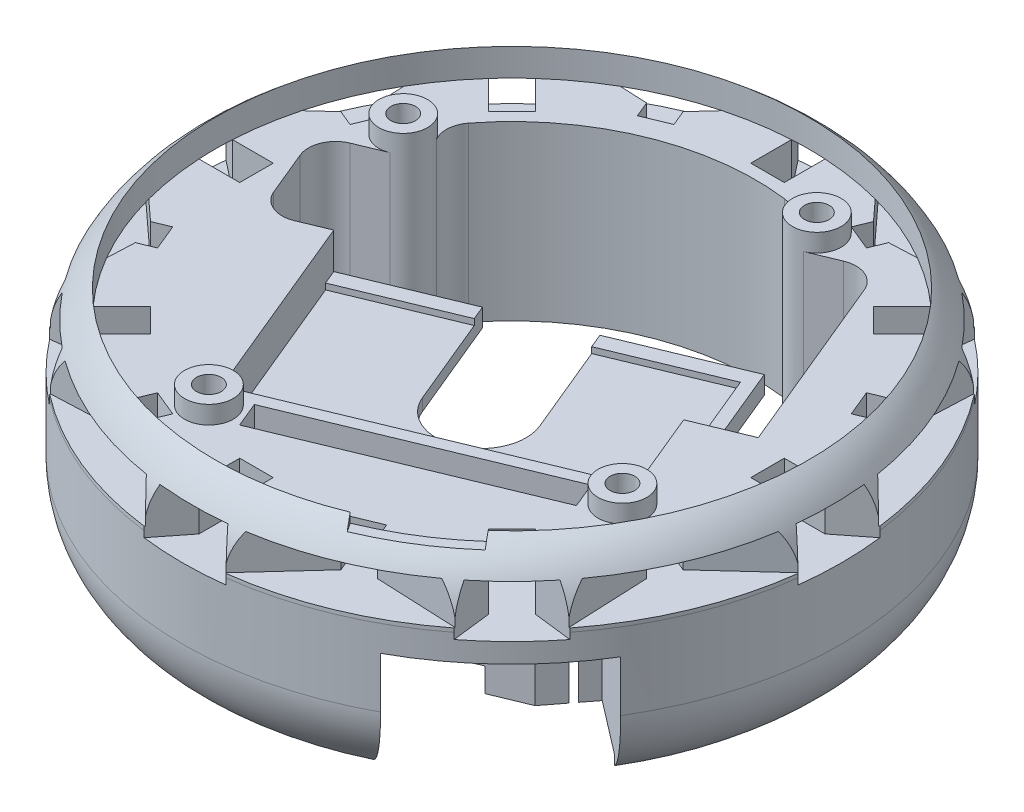
from build123d import *
from build123d.topology import SkipClean

# Parameters (mm, degrees)
SKETCH1_R                  = 49.53
BOSS_EXTRUDE1_DEPTH        = 9
BOSS_EXTRUDE12_START       = -30.41
SKETCH35_R                 = 55
SKETCH35_R_2               = 49.53
BOSS_EXTRUDE12_DEPTH       = 35
FILLET15_R                 = 14
CUT_EXTRUDE2_START         = -7.55
CUT_EXTRUDE2_DEPTH         = 7.55
CUT_EXTRUDE6_START         = -5.89
CUT_EXTRUDE6_DEPTH         = 5.89
CIRPATTERN1_COUNT          = 8
CIRPATTERN2_COUNT          = 8
SKETCH2_R                  = 40.65
CUT_EXTRUDE1_DEPTH         = 84.5150771477823
BOSS_EXTRUDE5_DEPTH        = 9
CUT_EXTRUDE25_DEPTH        = 84.5150771477823
CUT_EXTRUDE25_DEPTH_BACK   = 84.5150771477823
SKETCH22_R                 = 2.064000000000005
CUT_EXTRUDE12_DEPTH        = 84.5150771477823
BOSS_EXTRUDE6_DEPTH        = 2
SKETCH32_R                 = 2.064
CUT_EXTRUDE16_DEPTH        = 84.5150771477823
CUT_EXTRUDE19_DEPTH        = 6
BOSS_EXTRUDE10_OUTLINE_R   = 49.53
BOSS_EXTRUDE10_OUTLINE_R_2 = 2.064
BOSS_EXTRUDE10_OUTLINE_R_3 = 2.065
BOSS_EXTRUDE10_DEPTH       = 19.82
FILLET13_R                 = 4.5
CUT_EXTRUDE18_START        = -11.530000000000001
CUT_EXTRUDE18_DEPTH        = 10.5
FILLET9_R                  = 1.6
BOSS_EXTRUDE13_START       = 1.59
BOSS_EXTRUDE13_DEPTH       = 1.59
CUT_EXTRUDE20_DEPTH        = 2
FILLET9_OF_MIRROR9_R       = 1.6
CUT_EXTRUDE21_DEPTH        = 4
CUT_EXTRUDE22_DEPTH        = 18.240000000000002
CUT_EXTRUDE23_DEPTH        = 9
CUT_EXTRUDE24_DEPTH        = 6
BOSS_EXTRUDE15_START       = 3
SKETCH52_R                 = 4.064999999999999
SKETCH52_R_2               = 2.0639999999999983
SKETCH52_R_3               = 2.0639999999999965
SKETCH52_R_4               = 4.065
SKETCH52_R_5               = 2.0640000000000014
SKETCH52_R_6               = 2.064000000000005
BOSS_EXTRUDE15_DEPTH       = 3
CUT_EXTRUDE26_START        = 3
CUT_EXTRUDE26_DEPTH        = 81.51507725005126
CUT_EXTRUDE28_DEPTH        = 85.6535771759353
CUT_EXTRUDE28_DEPTH_BACK   = 3.6
CUT_EXTRUDE29_DEPTH        = 85.6535771759353
CUT_EXTRUDE29_DEPTH_BACK   = 18


# Read off the part's stored shape, not the designer's step: Boss-Extrude10
with BuildPart() as part:
    # Sketch1 → Boss-Extrude1 (new body)
    with BuildSketch(Plane(origin=(0, 0, 0), x_dir=(1, 0, 0), z_dir=(0, 1, 0))):
        with Locations(Location((0, 0, 0), (0, 0, 270))):
            Circle(SKETCH1_R)
    extrude(amount=BOSS_EXTRUDE1_DEPTH)

    # Sketch35 → Boss-Extrude12 (add)
    with BuildSketch(Plane(origin=(0, 9, 0), x_dir=(1, 0, 0), z_dir=(0, 1, 0)).offset(BOSS_EXTRUDE12_START)):
        with Locations(Location((0, 0, 0), (0, 0, 270))):
            Circle(SKETCH35_R)
        with Locations(Location((0, 0, 0), (0, 0, 270))):
            Circle(SKETCH35_R_2, mode=Mode.SUBTRACT)
    extrude(amount=BOSS_EXTRUDE12_DEPTH)

    # Fillet15
    # the kernel refuses this fillet: 14 mm, written as the material it takes off along each edge
    with BuildSketch(Plane(origin=(0, -21.41, 0), x_dir=(-1.8e-16, 0, 1), z_dir=(-1, 0, -1.8e-16))) as fillet15_piece_1:
        with BuildLine():
            CenterArc((41, 11.101310733422428), FILLET15_R, 307.53787335909544, 52.46212664090456)
            Line((49.53, 0), (49.7006, -0.22202621466844974))
            ThreePointArc((49.7006, -0.22202621466844974), (52.265, -0.28000000000000114), (55, -0.28000000000000114))
            Line((55, -0.28000000000000114), (55.28, 0))
            Line((55.28, 0), (55.28, 11.101310733422428))
            Line((55.28, 11.101310733422428), (55, 11.101310733422428))
        make_face()
    revolve(axis=Axis((0, -21.41, 0), (0, 1, 0)), mode=Mode.SUBTRACT)
    with BuildSketch(Plane(origin=(0, 13.59, 0), x_dir=(-1.8e-16, 0, 1), z_dir=(-1, 0, -1.8e-16))) as fillet15_piece_2:
        with BuildLine():
            CenterArc((41, -11.101310733422427), FILLET15_R, 0, 52.46212664090458)
            Line((49.53, 0), (49.7006, 0.22202621466844796))
            ThreePointArc((49.7006, 0.22202621466844796), (52.265, 0.27999999999999936), (55, 0.27999999999999936))
            Line((55, 0.27999999999999936), (55.28, 0))
            Line((55.28, 0), (55.28, -11.101310733422427))
            Line((55.28, -11.101310733422427), (55, -11.101310733422427))
        make_face()
    revolve(axis=Axis((0, 13.59, 0), (0, 1, 0)), mode=Mode.SUBTRACT)

    # Sketch3 → Cut-Extrude2 (cut)
    with BuildSketch(Plane(origin=(0, 9, 0), x_dir=(1, 0, 0), z_dir=(0, 1, 0)).offset(CUT_EXTRUDE2_START)):
        with BuildLine():
            Line((-2.7999999999999914, -49.4517830676869), (-2.7999999999999914, -42.64999999999999))
            Line((-2.7999999999999914, -42.64999999999999), (2.800000000000009, -42.64999999999999))
            Line((2.800000000000009, -42.64999999999999), (2.800000000000009, -49.4517830676869))
            Line((2.800000000000009, -49.4517830676869), (6.837503484166983, -54.57333182154086))
            ThreePointArc((6.837503484166983, -54.57333182154086), (3.37e-15, -54.99999999999999), (-6.8375034841669615, -54.573331821540854))
            Line((-6.8375034841669615, -54.573331821540854), (-2.7999999999999914, -49.4517830676869))
        make_face()
    cut_extrude2 = extrude(amount=CUT_EXTRUDE2_DEPTH, mode=Mode.SUBTRACT)

    # Sketch9 → Cut-Extrude6 (cut)
    with BuildSketch(Plane(origin=(0, 9, 0), x_dir=(1, 0, 0), z_dir=(0, 1, 0)).offset(CUT_EXTRUDE6_START)):
        with BuildLine():
            Line((-20.200334185550535, -42.6662717092523), (-33.95556960487727, -43.26683825758862))
            ThreePointArc((-33.95556960487727, -43.26683825758862), (-21.047588780079966, -50.813374288120755), (-6.584061205781987, -54.60448825910299))
            Line((-6.584061205781987, -54.60448825910299), (-15.885816768722863, -44.453403338397266))
            Line((-15.885816768722863, -44.453403338397266), (-14.7994441796833, -41.83066790014758))
            Line((-14.7994441796833, -41.83066790014758), (-19.113961596511007, -40.04353627100263))
            Line((-19.113961596511007, -40.04353627100263), (-20.200334185550535, -42.6662717092523))
        make_face()
    cut_extrude6 = extrude(amount=CUT_EXTRUDE6_DEPTH, mode=Mode.SUBTRACT)

    # CirPattern1: Cut-Extrude2 ×8 about axis
    cirpattern1_axis = Axis((-1.58e-15, 0, -1.31e-15), (0, 1, 0))
    for i in range(1, CIRPATTERN1_COUNT):
        add(cut_extrude2.rotate(cirpattern1_axis, i * 360 / CIRPATTERN1_COUNT), mode=Mode.SUBTRACT)

    # CirPattern2: Cut-Extrude6 ×8 about axis
    cirpattern2_axis = Axis((8.5e-16, 0, -2.29e-15), (0, 1, 0))
    for i in range(1, CIRPATTERN2_COUNT):
        add(cut_extrude6.rotate(cirpattern2_axis, i * 360 / CIRPATTERN2_COUNT), mode=Mode.SUBTRACT)

    # Sketch2 → Cut-Extrude1 (cut, through all)
    with BuildSketch(Plane(origin=(0, 9, 0), x_dir=(1, 0, 0), z_dir=(0, 1, 0))):
        with Locations(Location((0, 0, 0), (0, 0, 270))):
            Circle(SKETCH2_R)
    extrude(amount=-CUT_EXTRUDE1_DEPTH, mode=Mode.SUBTRACT)

    # Sketch13 → Boss-Extrude5 (add)
    # profile 1 of 3: a face of its own
    with BuildSketch(Plane(origin=(0, 9, 0), x_dir=(1, 0, 0), z_dir=(0, 1, 0))):
        with BuildLine():
            Line((-38.45360589331033, -1.3157103792115723), (-40.490185271032125, 3.6010271753338756))
            ThreePointArc((-40.490185271032125, 3.6010271753338756), (15.556081525640508, -37.55570299658397), (26.084573841731473, 31.177195311561583))
            Line((26.084573841731473, 31.177195311561583), (29.84322866509611, 22.10299986071537))
            Line((29.84322866509611, 22.10299986071537), (3.4849456025489953, 11.185041535339597))
            Line((3.4849456025489953, 11.185041535339597), (4.453134686432639, 8.84762631808604))
            Line((4.453134686432639, 8.84762631808604), (22.006845804147147, 16.118611533022584))
            Line((22.006845804147147, 16.118611533022584), (34.252715639829724, -13.445533507338707))
            Line((34.252715639829724, -13.445533507338707), (-14.712899583268623, -33.72775542268797))
            Line((-14.712899583268623, -33.72775542268797), (-26.958769418951192, -4.163610382326719))
            Line((-26.958769418951192, -4.163610382326719), (-9.405058301236702, 3.107374832609818))
            Line((-9.405058301236702, 3.107374832609818), (-10.373247385120358, 5.444790049863378))
            Line((-10.373247385120358, 5.444790049863378), (-32.574072551366655, -3.7510928298695125))
            ThreePointArc((-32.574072551366655, -3.7510928298695125), (-36.01822344265246, -3.7510928298694854), (-38.45360589331033, -1.3157103792115723))
        make_face()
        Polygon((-7.604610466032192, -37.86225065497186), (-9.341993248969676, -33.66783757737061), (30.412543034991042, -17.20096948270106), (32.149925817928526, -21.395382560302316), align=None, mode=Mode.SUBTRACT)
    # profile 2 of 3: a face of its own
    with BuildSketch(Plane(origin=(0, 9, 0), x_dir=(1, 0, 0), z_dir=(0, 1, 0))):
        with BuildLine():
            Line((14.395985241115941, 34.28380425124336), (18.728730419910317, 36.07848606660658))
            ThreePointArc((18.728730419910317, 36.07848606660658), (14.02409589893612, 38.154255781202735), (9.095044900992207, 39.61947322023523))
            ThreePointArc((9.095044900992207, 39.61947322023523), (9.956618486653129, 35.174385663318596), (14.395985241115941, 34.28380425124336))
        make_face()
    # profile 3 of 3: a face of its own
    with BuildSketch(Plane(origin=(0, 9, 0), x_dir=(1, 0, 0), z_dir=(0, 1, 0))):
        with BuildLine():
            Line((-34.421809256780584, 14.062811685072331), (-38.75455443557509, 12.268129869709064))
            ThreePointArc((-38.75455443557509, 12.268129869709064), (-36.895666304162425, 17.062599683866857), (-34.44636610575452, 21.58403025637997))
            ThreePointArc((-34.44636610575452, 21.58403025637997), (-31.91243907620284, 17.831654177004214), (-34.421809256780584, 14.062811685072331))
        make_face()
    extrude(amount=-BOSS_EXTRUDE5_DEPTH)

    # Sketch47 → Cut-Extrude25 (cut, two sides: drawn at the far end of the back side and taken through both)
    with BuildSketch(Plane(origin=(0, 9, 0), x_dir=(1, 0, 0), z_dir=(0, 1, 0)).offset(-CUT_EXTRUDE25_DEPTH_BACK)):
        with BuildLine():
            Line((-38.75455443557509, 12.268129869709067), (-43.30029156421409, 10.385223900043922))
            Line((-43.30029156421409, 10.385223900043922), (-40.490185271032125, 3.601027175333881))
            ThreePointArc((-40.490185271032125, 3.601027175333881), (-39.85864849779397, 7.981894507528047), (-38.75455443557509, 12.268129869709067))
        make_face()
        with BuildLine():
            Line((18.72873041991032, 36.07848606660659), (23.27446754854944, 37.961392036271796))
            Line((23.27446754854944, 37.961392036271796), (26.084573841731473, 31.177195311561587))
            ThreePointArc((26.084573841731473, 31.177195311561587), (22.540268908732948, 33.82837237470946), (18.72873041991032, 36.07848606660659))
        make_face()
    extrude(amount=CUT_EXTRUDE25_DEPTH + CUT_EXTRUDE25_DEPTH_BACK, mode=Mode.SUBTRACT)

    # Sketch22 → Cut-Extrude12 (cut, through all)
    with BuildSketch(Plane(origin=(0, 9, 0), x_dir=(1, 0, 0), z_dir=(0, 1, 0))):
        with Locations(Location((35.77778797384373, -17.34688639781453, 0), (0, 0, 270))):
            Circle(SKETCH22_R)
    cut_extrude12 = extrude(amount=-CUT_EXTRUDE12_DEPTH, mode=Mode.SUBTRACT)

    # Sketch24 → Boss-Extrude6 (add)
    with BuildSketch(Plane.XZ):
        with BuildLine():
            Line((34.25271563982973, 13.445533507338702), (22.006845804147144, -16.11861153302257))
            Line((22.006845804147144, -16.11861153302257), (4.453134686432655, -8.84762631808604))
            Line((4.453134686432655, -8.84762631808604), (10.576069604273945, 5.934446202094583))
            ThreePointArc((10.576069604273945, 5.934446202094583), (10.57606960427389, 11.674697687570937), (6.517098853177364, 15.733668438667376))
            Line((6.517098853177364, 15.733668438667376), (9.769908028280563, 23.586644465013343))
            Line((9.769908028280563, 23.586644465013343), (34.25271563982973, 13.445533507338702))
        make_face()
    boss_extrude6 = extrude(amount=-BOSS_EXTRUDE6_DEPTH)

    # Sketch32 → Cut-Extrude16 (cut, through all)
    with BuildSketch(Plane(origin=(0, 9, 0), x_dir=(1, 0, 0), z_dir=(0, 1, 0))):
        with Locations(Location((12.840377088551888, 38.039374550901755, 0), (0, 0, 270))):
            Circle(SKETCH32_R)
    cut_extrude16 = extrude(amount=-CUT_EXTRUDE16_DEPTH, mode=Mode.SUBTRACT)

    # Sketch37 → Cut-Extrude19 (cut)
    with BuildSketch(Plane(origin=(0, 9, 0), x_dir=(1, 0, 0), z_dir=(0, 1, 0))):
        Polygon((22.00684580414717, 16.118611533022584), (4.453134686432659, 8.847626318086038), (3.4849456025490033, 11.185041535339598), (21.038656720263514, 18.456026750276145), align=None)
    cut_extrude19 = extrude(amount=-CUT_EXTRUDE19_DEPTH, mode=Mode.SUBTRACT)

    # Mirror8: Cut-Extrude12, Boss-Extrude6, Cut-Extrude16, Cut-Extrude19 across plane
    add(cut_extrude12.mirror(Plane(origin=(0, 0, 0), x_dir=(0.3826834323650813, 0, 0.9238795325112903), z_dir=(0.9238795325112904, 0, -0.38268343236508123))), mode=Mode.SUBTRACT)
    add(boss_extrude6.mirror(Plane(origin=(0, 0, 0), x_dir=(0.3826834323650813, 0, 0.9238795325112903), z_dir=(0.9238795325112904, 0, -0.38268343236508123))))
    add(cut_extrude16.mirror(Plane(origin=(0, 0, 0), x_dir=(0.3826834323650813, 0, 0.9238795325112903), z_dir=(0.9238795325112904, 0, -0.38268343236508123))), mode=Mode.SUBTRACT)
    add(cut_extrude19.mirror(Plane(origin=(0, 0, 0), x_dir=(0.3826834323650813, 0, 0.9238795325112903), z_dir=(0.9238795325112904, 0, -0.38268343236508123))), mode=Mode.SUBTRACT)

    # Boss-Extrude10 outline → Boss-Extrude10 (add)
    with BuildSketch(Plane.XZ):
        Circle(BOSS_EXTRUDE10_OUTLINE_R)
        with Locations((-35.977417409, -17.818381985)):
            Circle(BOSS_EXTRUDE10_OUTLINE_R_2, mode=Mode.SUBTRACT)
        with BuildLine():
            ThreePointArc((14.395985241, -34.283804251), (9.956618487, -35.174385663), (9.095044901, -39.61947322))
            ThreePointArc((9.095044901, -39.61947322), (-15.556081526, -37.555702997), (-34.446366106, -21.584030256))
            ThreePointArc((-34.446366106, -21.584030256), (-31.912439076, -17.831654177), (-34.421809257, -14.062811685))
            Line((-34.421809257, -14.062811685), (-43.300291564, -10.3852239))
            Line((-43.300291564, -10.3852239), (-27.4679126, 27.837520119))
            ThreePointArc((-27.4679126, 27.837520119), (-22.267018078, 33.038414641), (-14.911842508, 33.038414641))
            Line((-14.911842508, 33.038414641), (-14.90814699, 33.036883908))
            ThreePointArc((-14.90814699, 33.036883908), (-11.157083986, 33.036883908), (-8.504681899, 35.689285995))
            Line((-8.504681899, 35.689285995), (-7.604610466, 37.862250655))
            Line((-7.604610466, 37.862250655), (32.149925818, 21.39538256))
            Line((32.149925818, 21.39538256), (31.249854385, 19.2224179))
            ThreePointArc((31.249854385, 19.2224179), (31.249854385, 15.471354896), (33.902256472, 12.818952809))
            Line((33.902256472, 12.818952809), (33.90595199, 12.817422075))
            ThreePointArc((33.90595199, 12.817422075), (39.106846512, 7.616527553), (39.106846512, 0.261351983))
            Line((39.106846512, 0.261351983), (23.274467549, -37.961392036))
            Line((23.274467549, -37.961392036), (14.395985241, -34.283804251))
        make_face(mode=Mode.SUBTRACT)
        with Locations((12.840377089, -38.039374551)):
            Circle(BOSS_EXTRUDE10_OUTLINE_R_3, mode=Mode.SUBTRACT)
        with Locations((-13.032615488, 37.564817497)):
            Circle(BOSS_EXTRUDE10_OUTLINE_R_2, mode=Mode.SUBTRACT)
        with Locations((35.777787974, 17.346886398)):
            Circle(BOSS_EXTRUDE10_OUTLINE_R_2, mode=Mode.SUBTRACT)
    extrude(amount=BOSS_EXTRUDE10_DEPTH)

    # Fillet13
    fillet13_edges = [part.edges().sort_by_distance(p)[0] for p in [
        (-34.446366106, -9.91, -21.584030256),
        (9.095044900999998, -9.91, -39.61947322),
        (-43.300291564, -9.91, -10.3852239),
        (23.274467549, -9.91, -37.961392036),
    ]]
    fillet(fillet13_edges, radius=FILLET13_R)

    # Sketch36 → Cut-Extrude18 (cut)
    with BuildSketch(Plane(origin=(-24.482807611549177, 0, 10.141110957674638), x_dir=(-0.38268343236508107, 0, -0.9238795325112904), z_dir=(0.9238795325112904, 0, -0.38268343236508107)).offset(CUT_EXTRUDE18_START)):
        with BuildLine():
            Line((-17.799999999999997, -15.69), (-17.79999999999999, -35.69))
            Line((-17.79999999999999, -35.69), (17.800000000000008, -35.69))
            Line((17.800000000000008, -35.69), (17.800000000000004, -15.689999999999996))
            ThreePointArc((17.800000000000004, -15.689999999999996), (-1.13e-15, 2.1100000000000048), (-17.799999999999997, -15.69))
        make_face()
    cut_extrude18 = extrude(amount=-CUT_EXTRUDE18_DEPTH, mode=Mode.SUBTRACT)

    # Fillet9
    fillet9_edges = [part.edges().sort_by_distance(p)[0] for p in [
        (-51.647638808871356, -17.51857997737267, 2.1265712939764008),
        (-44.83587371277291, 2.1100000000000048, 18.57162697267737),
        (-41.946903717502806, -17.755, -1.8916047458569523),
        (-35.13513862140436, 2.1100000000000048, 14.553450932844019),
        (-38.02410861667447, -17.518579977372674, 35.016682651378346),
        (-28.323373525305918, -17.755, 30.99850661154499),
    ]]
    fillet(fillet9_edges, radius=FILLET9_R)

    # Sketch40 → Boss-Extrude13 (add)
    with BuildSketch(Plane.XZ.offset(19.82).offset(BOSS_EXTRUDE13_START)):
        with BuildLine():
            Line((-48.62540594227342, 9.422886869167074), (-41.046341483272414, 27.720367076187692))
            ThreePointArc((-41.046341483272414, 27.720367076187692), (-45.75975324528421, 18.954310405042474), (-48.62540594227342, 9.422886869167074))
        make_face()
    boss_extrude13 = extrude(amount=-BOSS_EXTRUDE13_DEPTH)

    # Sketch41 → Cut-Extrude20 (cut)
    with BuildSketch(Plane(origin=(-33.287379556381794, 0, 13.78808406811387), x_dir=(-0.3826834323650812, 0, -0.9238795325112904), z_dir=(0.9238795325112904, 0, -0.3826834323650812))):
        with BuildLine():
            Line((-7.103500000000058, -8.069999999999999), (5.396499999999943, -8.069999999999999))
            ThreePointArc((5.396499999999943, -8.069999999999999), (6.457160171779764, -8.509339828220178), (6.896499999999945, -9.569999999999999))
            Line((6.896499999999945, -9.569999999999999), (6.896499999999945, -19.82))
            Line((6.896499999999945, -19.82), (-8.60350000000006, -19.82))
            Line((-8.60350000000006, -19.82), (-8.603500000000059, -9.569999999999999))
            ThreePointArc((-8.603500000000059, -9.569999999999999), (-8.16416017177988, -8.509339828220176), (-7.103500000000058, -8.069999999999999))
        make_face()
    cut_extrude20 = extrude(amount=-CUT_EXTRUDE20_DEPTH, mode=Mode.SUBTRACT)

    # Mirror9: Cut-Extrude18, Boss-Extrude13, Cut-Extrude20 across plane
    add(cut_extrude18.mirror(Plane(origin=(0, 0, 0), x_dir=(0.3826834323650813, 0, 0.9238795325112903), z_dir=(0.9238795325112904, 0, -0.38268343236508123))), mode=Mode.SUBTRACT)
    add(boss_extrude13.mirror(Plane(origin=(0, 0, 0), x_dir=(0.3826834323650813, 0, 0.9238795325112903), z_dir=(0.9238795325112904, 0, -0.38268343236508123))))
    add(cut_extrude20.mirror(Plane(origin=(0, 0, 0), x_dir=(0.3826834323650813, 0, 0.9238795325112903), z_dir=(0.9238795325112904, 0, -0.38268343236508123))), mode=Mode.SUBTRACT)

    # Fillet9 of Mirror9
    fillet9_of_mirror9_edges = [part.edges().sort_by_distance(p)[0] for p in [
        (38.02410861667447, -17.51857997737267, -35.016682651378375),
        (44.835873712772916, 2.1100000000000048, -18.571626972677407),
        (28.323373525305918, -17.755, -30.998506611545025),
        (35.135138621404366, 2.1100000000000048, -14.55345093284405),
        (51.64763880887137, -17.518579977372674, -2.12657129397644),
        (41.94690371750281, -17.755, 1.8916047458569167),
    ]]
    fillet(fillet9_of_mirror9_edges, radius=FILLET9_OF_MIRROR9_R)

    # Sketch42 → Cut-Extrude21 (cut)
    with BuildSketch(Plane.XZ.offset(19.82)):
        with BuildLine():
            Line((2.424101859377788, 33.70822199664889), (22.121213492518475, 25.5494112186253))
            Line((22.121213492518475, 25.5494112186253), (24.723460832601038, 31.83179203970206))
            ThreePointArc((24.723460832601038, 31.83179203970206), (18.954310405042506, 45.7597532452842), (5.026349199460363, 39.99060281772565))
            Line((5.026349199460363, 39.99060281772565), (2.424101859377788, 33.70822199664889))
        make_face()
    extrude(amount=-CUT_EXTRUDE21_DEPTH, mode=Mode.SUBTRACT)

    # Sketch43 → Cut-Extrude22 (cut)
    with BuildSketch(Plane.XZ.offset(19.82)):
        Polygon((31.515615190904068, 23.82290702535802), (35.34244951455491, 33.06170235047092), (-1.6127317858966677, 48.36903964507428), (-5.439566109547508, 39.130244319961385), align=None)
    extrude(amount=-CUT_EXTRUDE22_DEPTH, mode=Mode.SUBTRACT)

    # Sketch45 → Cut-Extrude23 (cut)
    with BuildSketch(Plane.XZ):
        Polygon((30.551564935558563, -0.7160865788051782), (22.88641578528588, -19.221393615006225), (29.843228665096113, -22.10299986071537), (37.50837781536865, -3.597692824514315), align=None)
    extrude(amount=-CUT_EXTRUDE23_DEPTH, mode=Mode.SUBTRACT)

    # Sketch46 → Cut-Extrude24 (cut)
    with BuildSketch(Plane(origin=(0, 9, 0), x_dir=(1, 0, 0), z_dir=(0, 1, 0))):
        Polygon((30.551564935558623, 0.7160865788051831), (22.88641578528607, 19.221393615006296), (21.038656720263486, 18.456026750276134), (28.70380587053605, -0.04928028592497593), align=None)
    extrude(amount=-CUT_EXTRUDE24_DEPTH, mode=Mode.SUBTRACT)

    # Sketch52 → Boss-Extrude15 (add)
    # profile 1 of 4: a face of its own
    with SkipClean():  # the faces are left unmerged after this step: merging them gives an invalid solid
        with BuildSketch(Plane(origin=(0, 9, 0), x_dir=(1, 0, 0), z_dir=(0, 1, 0)).offset(BOSS_EXTRUDE15_START)):
            with Locations(Location((-35.97741740934471, 17.81838198473086, 0), (0, 0, 270))):
                Circle(SKETCH52_R)
            with Locations(Location((-35.97741740934471, 17.81838198473086, 0), (0, 0, 270))):
                Circle(SKETCH52_R_2, mode=Mode.SUBTRACT)
        # profile 2 of 4: a face of its own
        with BuildSketch(Plane(origin=(0, 9, 0), x_dir=(1, 0, 0), z_dir=(0, 1, 0)).offset(BOSS_EXTRUDE15_START)):
            with Locations(Location((12.840377088551888, 38.039374550901755, 0), (0, 0, 270))):
                Circle(SKETCH52_R)
            with Locations(Location((12.840377088551888, 38.039374550901755, 0), (0, 0, 270))):
                Circle(SKETCH52_R_3, mode=Mode.SUBTRACT)
        # profile 3 of 4: a face of its own
        with BuildSketch(Plane(origin=(0, 9, 0), x_dir=(1, 0, 0), z_dir=(0, 1, 0)).offset(BOSS_EXTRUDE15_START)):
            with Locations(Location((-13.032615487792766, -37.5648174965265, 0), (0, 0, 270))):
                Circle(SKETCH52_R_4)
            with Locations(Location((-13.032615487792766, -37.5648174965265, 0), (0, 0, 270))):
                Circle(SKETCH52_R_5, mode=Mode.SUBTRACT)
        # profile 4 of 4: a face of its own
        with BuildSketch(Plane(origin=(0, 9, 0), x_dir=(1, 0, 0), z_dir=(0, 1, 0)).offset(BOSS_EXTRUDE15_START)):
            with Locations(Location((35.77778797384373, -17.34688639781453, 0), (0, 0, 270))):
                Circle(SKETCH52_R)
            with Locations(Location((35.77778797384373, -17.34688639781453, 0), (0, 0, 270))):
                Circle(SKETCH52_R_6, mode=Mode.SUBTRACT)
        extrude(amount=-BOSS_EXTRUDE15_DEPTH)

    # Sketch54 → Cut-Extrude26 (cut, through all)
    with SkipClean():  # the faces are left unmerged after this step: merging them gives an invalid solid
        with BuildSketch(Plane(origin=(0, 9, 0), x_dir=(1, 0, 0), z_dir=(0, 1, 0)).offset(CUT_EXTRUDE26_START)):
            Polygon((14.230879898588523, -38.86337228645432), (28.17283921508754, -29.67034392703506), (38.529838190915996, -45.37755734099913), (24.587878874416976, -54.57058570041839), align=None)
        extrude(amount=CUT_EXTRUDE26_DEPTH, mode=Mode.SUBTRACT)

    # Sketch56 → Cut-Extrude28 (cut, two sides: drawn at the far end of the back side and taken through both)
    with SkipClean():  # the faces are left unmerged after this step: merging them gives an invalid solid
        with BuildSketch(Plane.XZ.offset(19.82).offset(-CUT_EXTRUDE28_DEPTH_BACK)):
            Polygon((39.610677061021875, 37.02155047995948), (32.532764623167395, 31.59047724784156), (38.61429129896468, 23.66487737833225), (45.69220373681915, 29.095950610450174), align=None)
        extrude(amount=CUT_EXTRUDE28_DEPTH + CUT_EXTRUDE28_DEPTH_BACK, mode=Mode.SUBTRACT)

    # Sketch57 → Cut-Extrude29 (cut, two sides: drawn at the far end of the back side and taken through both)
    with SkipClean():  # the faces are left unmerged after this step: merging them gives an invalid solid
        with BuildSketch(Plane.XZ.offset(19.82).offset(-CUT_EXTRUDE29_DEPTH_BACK)):
            Polygon((33.669579345934864, 18.610194034979862), (16.62425933369021, 40.82408756313407), (42.86654258006603, 60.96049972426727), (59.91186259231068, 38.746606196113035), align=None)
        extrude(amount=CUT_EXTRUDE29_DEPTH + CUT_EXTRUDE29_DEPTH_BACK, mode=Mode.SUBTRACT)


solid = part.part
